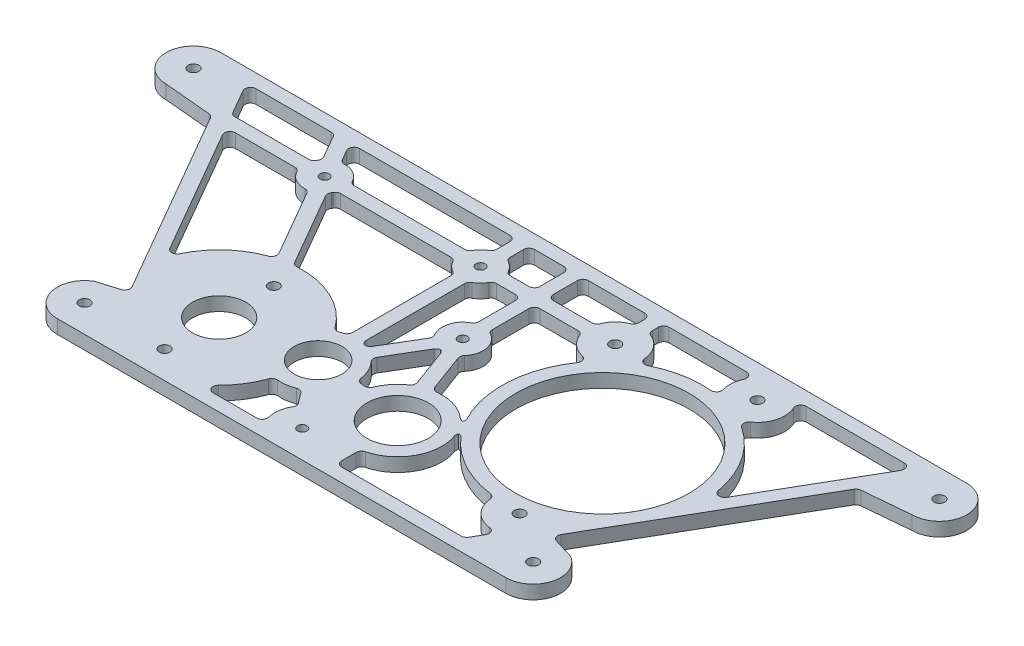
from build123d import *

# Parameters (mm, degrees)
SKETCH1_R           = 2.4892
SKETCH1_R_2         = 12.3825
SKETCH1_R_3         = 14.3002
SKETCH1_R_4         = 11.1252
SKETCH1_R_5         = 40.3225
BOSS_EXTRUDE1_DEPTH = 6.35
SKETCH2_R           = 2.15265
CUT_EXTRUDE1_DEPTH  = 200.93067318
FILLET1_R           = 2.54


with BuildPart() as part:
    # Sketch1 → Boss-Extrude1 (new body)
    with BuildSketch(Plane(origin=(0, 0, 0), x_dir=(1, 0, 0), z_dir=(0, 1, 0))):
        with BuildLine():
            ThreePointArc((-173.478687828, 72.590962089), (-186.178687828, 59.890962089), (-173.478687828, 47.190962089))
            Line((-173.478687828, 47.190962089), (-150.271339409, 45.094655518))
            Line((-150.271339409, 45.094655518), (-98.200516404, -45.094655518))
            Line((-98.200516404, -45.094655518), (-110.67256166, -48.892439461))
            ThreePointArc((-110.67256166, -48.892439461), (-116.589819654, -63.177963961), (-104.32256166, -72.590962089))
            Line((-104.32256166, -72.590962089), (104.322561739, -72.590962089))
            ThreePointArc((104.322561739, -72.590962089), (116.589819664, -63.177963923), (110.67256166, -48.892439461))
            Line((110.67256166, -48.892439461), (98.200516404, -45.094655518))
            Line((98.200516404, -45.094655518), (150.271339409, 45.094655518))
            Line((150.271339409, 45.094655518), (173.478687828, 47.190962089))
            ThreePointArc((173.478687828, 47.190962089), (186.178687828, 59.890962094), (173.478687816, 72.590962089))
            Line((173.478687816, 72.590962089), (-173.478687828, 72.590962089))
        make_face()
        with Locations(Location((173.478687828, 59.890962089, 0), (0, 0, 270))):
            Circle(SKETCH1_R, mode=Mode.SUBTRACT)
        with Locations(Location((-104.32256166, -59.890962089, 0), (0, 0, 270))):
            Circle(SKETCH1_R, mode=Mode.SUBTRACT)
        with Locations(Location((-67.13289048, -59.890962089, 0), (0, 0, 270))):
            Circle(SKETCH1_R, mode=Mode.SUBTRACT)
        with Locations(Location((-67.13289048, -34.490962089, 0), (0, 0, 270))):
            Circle(SKETCH1_R_2, mode=Mode.SUBTRACT)
        with Locations(Location((-67.13289048, -9.090962089, 0), (0, 0, 270))):
            Circle(SKETCH1_R, mode=Mode.SUBTRACT)
        with Locations(Location((15.87430952, -34.490962089, 0), (0, 0, 270))):
            Circle(SKETCH1_R_3, mode=Mode.SUBTRACT)
        with Locations(Location((81.671791392, -43.565397329, 0), (0, 0, 270))):
            Circle(SKETCH1_R, mode=Mode.SUBTRACT)
        with Locations(Location((-26.911726221, -28.671379147, 0), (0, 0, 270))):
            Circle(SKETCH1_R_4, mode=Mode.SUBTRACT)
        with Locations(Location((-173.478687828, 59.890962089, 0), (0, 0, 270))):
            Circle(SKETCH1_R, mode=Mode.SUBTRACT)
        with Locations(Location((72.644027153, 3.985206637, 0), (0, 0, 270))):
            Circle(SKETCH1_R_5, mode=Mode.SUBTRACT)
        with Locations(Location((35.710881273, 46.848232392, 0), (0, 0, 270))):
            Circle(SKETCH1_R, mode=Mode.SUBTRACT)
        with Locations(Location((91.297923401, 57.401762089, 0), (0, 0, 270))):
            Circle(SKETCH1_R, mode=Mode.SUBTRACT)
        with Locations(Location((104.32256166, -59.890962089, 0), (0, 0, 270))):
            Circle(SKETCH1_R, mode=Mode.SUBTRACT)
    extrude(amount=BOSS_EXTRUDE1_DEPTH)

    # Sketch2 → Cut-Extrude1 (cut, through all)
    with BuildSketch(Plane(origin=(0, 6.35, 0), x_dir=(1, 0, 0), z_dir=(0, 1, 0))):
        with BuildLine():
            Line((-114.291971392, 66.240962089), (-155.147816781, 66.240962089))
            Line((-155.147816781, 66.240962089), (-145.784506175, 50.023232392))
            Line((-145.784506175, 50.023232392), (-108.409655593, 50.023232392))
            ThreePointArc((-108.409655593, 50.023232392), (-107.678291443, 51.610732392), (-106.66915819, 53.037862326))
            Line((-106.66915819, 53.037862326), (-114.291971392, 66.240962089))
        make_face()
        with BuildLine():
            Line((-108.409655593, 43.673232392), (-142.118331966, 43.673232392))
            Line((-142.118331966, 43.673232392), (-103.826781824, -22.649677955))
            ThreePointArc((-103.826781824, -22.649677955), (-93.871605761, -6.711495265), (-77.565085515, 2.628129746))
            Line((-77.565085515, 2.628129746), (-97.688902069, 37.483602459))
            ThreePointArc((-97.688902069, 37.483602459), (-104.191899472, 38.599340421), (-108.409655593, 43.673232392))
        make_face()
        with BuildLine():
            Line((-30.086726221, 66.240962089), (-106.959622973, 66.240962089))
            Line((-106.959622973, 66.240962089), (-101.169896876, 56.212862326))
            ThreePointArc((-101.169896876, 56.212862326), (-94.666899472, 55.097124363), (-90.449143351, 50.023232392))
            Line((-90.449143351, 50.023232392), (-35.891982342, 50.023232392))
            ThreePointArc((-35.891982342, 50.023232392), (-33.646918312, 53.583424483), (-30.086726221, 55.828488513))
            Line((-30.086726221, 55.828488513), (-30.086726221, 66.240962089))
        make_face()
        with BuildLine():
            Line((-5.064866819, 66.240962089), (-23.736726221, 66.240962089))
            Line((-23.736726221, 66.240962089), (-23.736726221, 55.828488513))
            ThreePointArc((-23.736726221, 55.828488513), (-20.17653413, 53.583424483), (-17.9314701, 50.023232392))
            Line((-17.9314701, 50.023232392), (-5.064866819, 50.023232392))
            Line((-5.064866819, 50.023232392), (-5.064866819, 66.240962089))
        make_face()
        with BuildLine():
            ThreePointArc((-30.277440534, -45.819398922), (-36.042218421, -57.295079759), (-45.256072342, -66.240962089))
            Line((-45.256072342, -66.240962089), (-14.119970434, -66.240962089))
            ThreePointArc((-14.119970434, -66.240962089), (-15.846964873, -58.944223353), (-13.156814969, -51.945080588))
            Line((-13.156814969, -51.945080588), (-19.016243297, -44.261246512))
            ThreePointArc((-19.016243297, -44.261246512), (-24.516593521, -45.981663789), (-30.277440534, -45.819398922))
        make_face()
        with BuildLine():
            Line((-92.189640755, 40.658602459), (-70.953473966, 3.876482623))
            ThreePointArc((-70.953473966, 3.876482623), (-50.606128498, 0.34470656), (-34.999931114, -13.180622011))
            ThreePointArc((-34.999931114, -13.180622011), (-32.606637362, -12.15016242), (-30.086726221, -11.487026089))
            Line((-30.086726221, -11.487026089), (-30.086726221, 37.867976271))
            ThreePointArc((-30.086726221, 37.867976271), (-33.646918312, 40.113040302), (-35.891982342, 43.673232392))
            Line((-35.891982342, 43.673232392), (-90.449143351, 43.673232392))
            ThreePointArc((-90.449143351, 43.673232392), (-91.180507501, 42.085732392), (-92.189640755, 40.658602459))
        make_face()
        with BuildLine():
            Line((32.535881273, 66.240962089), (1.285133181, 66.240962089))
            Line((1.285133181, 66.240962089), (1.285133181, 50.023232392))
            Line((1.285133181, 50.023232392), (23.414159149, 50.023232392))
            ThreePointArc((23.414159149, 50.023232392), (26.730625152, 55.828488513), (32.535881273, 59.144954517))
            Line((32.535881273, 59.144954517), (32.535881273, 66.240962089))
        make_face()
        with BuildLine():
            Line((-5.064866819, 43.673232392), (-17.9314701, 43.673232392))
            ThreePointArc((-17.9314701, 43.673232392), (-20.17653413, 40.113040302), (-23.736726221, 37.867976271))
            Line((-23.736726221, 37.867976271), (-23.736726221, -11.487026089))
            ThreePointArc((-23.736726221, -11.487026089), (-22.292714572, -11.817674913), (-20.881895425, -12.269435494))
            Line((-20.881895425, -12.269435494), (-9.199683839, 7.442564292))
            ThreePointArc((-9.199683839, 7.442564292), (-11.076115494, 16.066928187), (-5.064866819, 22.529554413))
            Line((-5.064866819, 22.529554413), (-5.064866819, 43.673232392))
        make_face()
        with BuildLine():
            Line((82.178792776, 66.240962089), (38.885881273, 66.240962089))
            Line((38.885881273, 66.240962089), (38.885881273, 59.144954517))
            ThreePointArc((38.885881273, 59.144954517), (46.665897295, 53.272998845), (47.992817781, 43.616509072))
            ThreePointArc((47.992817781, 43.616509072), (63.938484083, 49.838622824), (81.055024467, 49.89356514))
            ThreePointArc((81.055024467, 49.89356514), (78.627824983, 58.272742044), (82.178792776, 66.240962089))
        make_face()
        with BuildLine():
            Line((23.414159149, 43.673232392), (1.285133181, 43.673232392))
            Line((1.285133181, 43.673232392), (1.285133181, 22.529554413))
            ThreePointArc((1.285133181, 22.529554413), (7.486163922, 15.227294875), (4.202636108, 6.227615898))
            Line((4.202636108, 6.227615898), (11.775395446, -14.251652232))
            ThreePointArc((11.775395446, -14.251652232), (22.183371247, -14.828141839), (30.983742744, -20.414890631))
            Line((30.983742744, -20.414890631), (32.317275486, -19.511077243))
            ThreePointArc((32.317275486, -19.511077243), (26.154677059, 8.115894717), (37.0917211, 34.223523233))
            ThreePointArc((37.0917211, 34.223523233), (28.491922042, 36.399470379), (23.414159149, 43.673232392))
        make_face()
        with BuildLine():
            Line((19.04930952, -54.895621729), (19.04930952, -66.240962089))
            Line((19.04930952, -66.240962089), (78.659342195, -66.240962089))
            Line((78.659342195, -66.240962089), (84.618890894, -55.918720952))
            ThreePointArc((84.618890894, -55.918720952), (73.408080674, -53.209104354), (69.012784333, -42.545818839))
            ThreePointArc((69.012784333, -42.545818839), (50.576773731, -37.140923532), (35.879883701, -24.76753258))
            Line((35.879883701, -24.76753258), (34.546350959, -25.671345967))
            ThreePointArc((34.546350959, -25.671345967), (34.118154464, -44.165303496), (19.04930952, -54.895621729))
        make_face()
        with BuildLine():
            Line((-3.736957371, 4.205108573), (-15.419168957, -15.506891213))
            ThreePointArc((-15.419168957, -15.506891213), (-11.17857628, -21.065420432), (-9.456248686, -27.841367671))
            Line((-9.456248686, -27.841367671), (-3.91627225, -28.594892782))
            ThreePointArc((-3.91627225, -28.594892782), (-0.235830951, -21.57221083), (5.819540332, -16.453989598))
            Line((5.819540332, -16.453989598), (-1.753219005, 4.025278532))
            ThreePointArc((-1.753219005, 4.025278532), (-2.749801875, 4.063195999), (-3.736957371, 4.205108573))
        make_face()
        with BuildLine():
            Line((155.147816781, 66.240962089), (100.417054026, 66.240962089))
            ThreePointArc((100.417054026, 66.240962089), (103.546778148, 54.046831779), (94.640137161, 45.149431405))
            ThreePointArc((94.640137161, 45.149431405), (112.625046332, 28.065081257), (119.316126255, 4.178653576))
            Line((119.316126255, 4.178653576), (155.147816781, 66.240962089))
        make_face()
        with Locations(Location((-99.429399472, 46.848232392, 0), (0, 0, 270))):
            Circle(SKETCH2_R)
        with Locations(Location((-26.911726221, 46.848232392, 0), (0, 0, 270))):
            Circle(SKETCH2_R)
        with Locations(Location((-3.17569048, -59.797924273, 0), (0, 0, 270))):
            Circle(SKETCH2_R)
        with Locations(Location((-1.889866819, 13.549298291, 0), (0, 0, 270))):
            Circle(SKETCH2_R)
    extrude(amount=-CUT_EXTRUDE1_DEPTH, mode=Mode.SUBTRACT)

    # Fillet1
    # the kernel refuses this fillet: 2.54 mm, written as the material it adds along each edge
    with BuildSketch(Plane(origin=(-106.66915819, 6.35, -53.037862326), x_dir=(-0.4999999999999449, 0, -0.8660254037844705), z_dir=(0, -1, 0)), Plane(origin=(-30.086726221, 6.35, -55.828488513), x_dir=(0, 0, -1), z_dir=(0, -1, 0)), Plane(origin=(-92.189640755, 6.35, -40.658602459), x_dir=(0.5000000000000435, 0, 0.8660254037844134), z_dir=(0, -1, 0)), Plane(origin=(-17.9314701, 6.35, -50.023232392), x_dir=(1, 0, 0), z_dir=(0, -1, 0)), Plane(origin=(-5.064866819, 6.35, -22.529554413), x_dir=(0, 0, -1), z_dir=(0, -1, 0)), Plane(origin=(-3.736957371, 6.35, -4.205108573), x_dir=(-0.5098355463151732, 0, 0.860271884762898), z_dir=(0, -1, 0))) as fillet1_piece_1:
        with BuildLine():
            CenterArc((1.645326216, -2.54), FILLET1_R, 90, 61.726286369)
            ThreePointArc((-0.591638487, -1.336842105), (-0.270133815, -0.679788504), (0, 0))
            Line((0, 0), (1.645326216, 0))
        make_face()
    extrude(amount=6.35)
    with BuildSketch(Plane(origin=(-108.409655593, 6.35, -50.023232392), x_dir=(-1, 0, 0), z_dir=(0, -1, 0)), Plane(origin=(-35.891982342, 6.35, -50.023232392), x_dir=(-1, 0, 0), z_dir=(0, -1, 0)), Plane(origin=(-101.169896876, 6.35, -56.212862326), x_dir=(-0.5000000000000248, 0, -0.8660254037844244), z_dir=(0, -1, 0)), Plane(origin=(-30.086726221, 6.35, -37.867976271), x_dir=(0, 0, 1), z_dir=(0, -1, 0)), Plane(origin=(-90.449143351, 6.35, -43.673232392), x_dir=(1, 0, 0), z_dir=(0, -1, 0)), Plane(origin=(-23.736726221, 6.35, -55.828488513), x_dir=(0, 0, -1), z_dir=(0, -1, 0)), Plane(origin=(-9.199683839, 6.35, -7.442564292), x_dir=(-0.5098355463151704, 0, 0.8602718847628997), z_dir=(0, -1, 0)), Plane(origin=(-17.9314701, 6.35, -43.673232392), x_dir=(1, 0, 0), z_dir=(0, -1, 0)), Plane(origin=(-1.753219005, 6.35, -4.025278532), x_dir=(0.34682478195255734, 0, 0.9379299390805056), z_dir=(0, -1, 0)), Plane(origin=(1.285133181, 6.35, -22.529554413), x_dir=(0, 0, -1), z_dir=(0, -1, 0)), Plane(origin=(-97.688902069, 6.35, -37.483602459), x_dir=(0.4999999999999665, 0, 0.8660254037844579), z_dir=(0, -1, 0))) as fillet1_piece_2:
        with BuildLine():
            CenterArc((1.645326216, 2.54), FILLET1_R, 208.273713631, 61.726286369)
            ThreePointArc((-0.591638487, 1.336842105), (-0.270133815, 0.679788504), (0, 0))
            Line((0, 0), (1.645326216, 0))
        make_face()
    extrude(amount=6.35)
    with BuildSketch(Plane(origin=(-145.784506175, 6.35, -50.023232392), x_dir=(-0.4999999999999971, 0, -0.8660254037844404), z_dir=(0, -1, 0)), Plane(origin=(-114.291971392, 6.35, -66.240962089), x_dir=(0.4999999999999971, 0, 0.8660254037844404), z_dir=(0, -1, 0)), Plane(origin=(78.659342195, 6.35, 66.240962089), x_dir=(-1, 0, 0), z_dir=(0, -1, 0))) as fillet1_piece_3:
        with BuildLine():
            CenterArc((FILLET1_R * 0.57735026919, FILLET1_R), FILLET1_R, 210, 60)
            Line((-FILLET1_R * 0.288675134595, FILLET1_R * 0.5), (0, 0))
            Line((0, 0), (FILLET1_R * 0.57735026919, 0))
        make_face()
    extrude(amount=6.35)
    with BuildSketch(Plane(origin=(-155.147816781, 6.35, -66.240962089), x_dir=(1, 0, 0), z_dir=(0, -1, 0)), Plane(origin=(-106.959622973, 6.35, -66.240962089), x_dir=(1, 0, 0), z_dir=(0, -1, 0)), Plane(origin=(155.147816781, 6.35, -66.240962089), x_dir=(-0.5000000000000048, 0, 0.8660254037844358), z_dir=(0, -1, 0)), Plane(origin=(-142.118331966, 6.35, -43.673232392), x_dir=(1, 0, 0), z_dir=(0, -1, 0))) as fillet1_piece_4:
        with BuildLine():
            CenterArc((FILLET1_R * 1.73205080757, FILLET1_R), FILLET1_R, 150, 120)
            Line((FILLET1_R * 0.866025403784, FILLET1_R * 1.5), (0, 0))
            Line((0, 0), (FILLET1_R * 1.73205080757, 0))
        make_face()
    extrude(amount=6.35)
    with BuildSketch(Plane(origin=(-90.449143351, 6.35, -50.023232392), x_dir=(-0.4047022051709242, 0, -0.9144485360750441), z_dir=(0, -1, 0)), Plane(origin=(-35.891982342, 6.35, -43.673232392), x_dir=(0.4047022051709187, 0, 0.9144485360750464), z_dir=(0, -1, 0)), Plane(origin=(-23.736726221, 6.35, -37.867976271), x_dir=(0.9144485360750448, 0, -0.40470220517092237), z_dir=(0, -1, 0)), Plane(origin=(4.202636108, 6.35, -6.227615898), x_dir=(0.7173279056690074, 0, -0.6967357287727647), z_dir=(0, -1, 0)), Plane(origin=(-108.409655593, 6.35, -43.673232392), x_dir=(0.404702205170935, 0, 0.9144485360750392), z_dir=(0, -1, 0))) as fillet1_piece_5:
        with BuildLine():
            CenterArc((1.656832134, 2.532509751), FILLET1_R, 203.872467133, 61.726286369)
            Line((-0.665867148, 1.50456615), (0, 0))
            ThreePointArc((0, 0), (0.730955353, 0.028088435), (1.461910706, 0))
        make_face()
    extrude(amount=6.35)
    with BuildSketch(Plane(origin=(-30.086726221, 6.35, -66.240962089), x_dir=(0, 0, 1), z_dir=(0, -1, 0)), Plane(origin=(38.885881273, 6.35, -66.240962089), x_dir=(1, 0, 0), z_dir=(0, -1, 0)), Plane(origin=(19.04930952, 6.35, 66.240962089), x_dir=(0, 0, -1), z_dir=(0, -1, 0)), Plane(origin=(-23.736726221, 6.35, -66.240962089), x_dir=(1, 0, 0), z_dir=(0, -1, 0)), Plane(origin=(-5.064866819, 6.35, -66.240962089), x_dir=(0, 0, 1), z_dir=(0, -1, 0)), Plane(origin=(-5.064866819, 6.35, -50.023232392), x_dir=(-1, 0, 0), z_dir=(0, -1, 0)), Plane(origin=(-5.064866819, 6.35, -43.673232392), x_dir=(0, 0, 1), z_dir=(0, -1, 0)), Plane(origin=(1.285133181, 6.35, -43.673232392), x_dir=(1, 0, 0), z_dir=(0, -1, 0)), Plane(origin=(1.285133181, 6.35, -50.023232392), x_dir=(0, 0, -1), z_dir=(0, -1, 0)), Plane(origin=(1.285133181, 6.35, -66.240962089), x_dir=(1, 0, 0), z_dir=(0, -1, 0)), Plane(origin=(32.535881273, 6.35, -66.240962089), x_dir=(0, 0, 1), z_dir=(0, -1, 0))) as fillet1_piece_6:
        with BuildLine():
            CenterArc((FILLET1_R, FILLET1_R), FILLET1_R, 180, 90)
            Line((0, FILLET1_R), (0, 0))
            Line((0, 0), (FILLET1_R, 0))
        make_face()
    extrude(amount=6.35)
    with BuildSketch(Plane(origin=(-30.086726221, 6.35, 11.487026089), x_dir=(-0.9722502226407513, 0, 0.23394337899374176), z_dir=(0, -1, 0)), Plane(origin=(-20.881895425, 6.35, 12.269435494), x_dir=(-0.9556721819283983, 0, -0.2944328118403492), z_dir=(0, -1, 0)), Plane(origin=(-9.456248686, 6.35, 27.841367671), x_dir=(-0.10077394544840815, 0, -0.9949093485935095), z_dir=(0, -1, 0))) as fillet1_piece_7:
        with BuildLine():
            CenterArc((2.002192205, 2.536375191), FILLET1_R, 193.529346775, 73.409289119)
            Line((-0.46732336, 1.942159009), (0, 0))
            ThreePointArc((0, 0), (0.933271163, 0.024938685), (1.866542327, 0))
        make_face()
    extrude(amount=6.35)
    with BuildSketch(Plane(origin=(-34.999931114, 6.35, 13.180622011), x_dir=(-0.574480497027429, 0, -0.8185182701290902), z_dir=(0, -1, 0))) as fillet1_piece_8:
        with BuildLine():
            CenterArc((2.10069809, 2.53911654), FILLET1_R, 193.928602659, 74.560180243)
            ThreePointArc((-0.364616858, 1.927706524), (-0.155234884, 0.968974099), (0, 0))
            ThreePointArc((0, 0), (1.016855772, 0.013410926), (2.033711543, 0))
        make_face()
    extrude(amount=6.35)
    with BuildSketch(Plane(origin=(-70.953473966, 6.35, -3.876482623), x_dir=(-0.5000000000000047, 0, -0.866025403784436), z_dir=(0, -1, 0))) as fillet1_piece_9:
        with BuildLine():
            CenterArc((1.603071132, 2.54), FILLET1_R, 206.620825162, 63.379174838)
            ThreePointArc((-0.667667105, 1.401866502), (-0.326775992, 0.704294556), (0, 0))
            Line((0, 0), (1.603071132, 0))
        make_face()
    extrude(amount=6.35)
    with BuildSketch(Plane(origin=(82.178792776, 6.35, -66.240962089), x_dir=(-0.5629589970624458, 0, 0.8264848260110073), z_dir=(0, -1, 0))) as fillet1_piece_10:
        with BuildLine():
            CenterArc((4.777889695, 2.502586051), FILLET1_R, 145.739319871, 114.414402315)
            Line((2.678618237, 3.932501904), (0, 0))
            ThreePointArc((0, 0), (2.171768043, 0.187069745), (4.343536086, 0))
        make_face()
    extrude(amount=6.35)
    with BuildSketch(Plane(origin=(81.055024467, 6.35, -49.89356514), x_dir=(-0.44549824782464786, 0, -0.8952828107280787), z_dir=(0, -1, 0))) as fillet1_piece_11:
        with BuildLine():
            CenterArc((4.749285509, -2.503035987), FILLET1_R, 99.786748421, 111.394026914)
            ThreePointArc((2.576218919, -3.818095527), (1.335237498, -1.877248626), (0, 0))
            ThreePointArc((0, 0), (2.15876614, -0.184820067), (4.31753228, 0))
        make_face()
    extrude(amount=6.35)
    with BuildSketch(Plane(origin=(47.992817781, 6.35, -43.616509072), x_dir=(0.08637714788447863, 0, -0.9962625097449682), z_dir=(0, -1, 0)), Plane(origin=(94.640137161, 6.35, -45.149431405), x_dir=(0.9059772162193113, 0, -0.4233264504983213), z_dir=(0, -1, 0))) as fillet1_piece_12:
        with BuildLine():
            CenterArc((4.749285509, 2.503035987), FILLET1_R, 148.819224665, 111.394026914)
            ThreePointArc((2.576218919, 3.818095527), (1.335237498, 1.877248626), (0, 0))
            ThreePointArc((0, 0), (2.15876614, 0.184820067), (4.31753228, 0))
        make_face()
    extrude(amount=6.35)
    with BuildSketch(Plane(origin=(38.885881273, 6.35, -59.144954517), x_dir=(0, 0, -1), z_dir=(0, -1, 0)), Plane(origin=(23.414159149, 6.35, -50.023232392), x_dir=(-1, 0, 0), z_dir=(0, -1, 0))) as fillet1_piece_13:
        with BuildLine():
            CenterArc((1.831135994, 2.54), FILLET1_R, 202.024312837, 67.975687163)
            ThreePointArc((-0.523507026, 1.5875), (-0.235606565, 0.802372432), (0, 0))
            Line((0, 0), (1.831135994, 0))
        make_face()
    extrude(amount=6.35)
    with BuildSketch(Plane(origin=(100.417054026, 6.35, -66.240962089), x_dir=(1, 0, 0), z_dir=(0, -1, 0))) as fillet1_piece_14:
        with BuildLine():
            CenterArc((4.758105388, 2.54), FILLET1_R, 155.585597685, 114.414402315)
            ThreePointArc((2.445232719, 3.589866667), (1.377226665, 1.689620737), (0, 0))
            Line((0, 0), (4.758105388, 0))
        make_face()
    extrude(amount=6.35)
    with BuildSketch(Plane(origin=(119.316126255, 6.35, -4.178653576), x_dir=(0.49999999999994416, 0, -0.8660254037844709), z_dir=(0, -1, 0))) as fillet1_piece_15:
        with BuildLine():
            CenterArc((8.029781391, -2.54), FILLET1_R, 90, 140.151547404)
            ThreePointArc((6.402253086, -4.490064516), (3.295328961, -2.110711756), (0, 0))
            Line((0, 0), (8.029781391, 0))
        make_face()
    extrude(amount=6.35)
    with BuildSketch(Plane(origin=(69.012784333, 6.35, 42.545818839), x_dir=(-0.9948351649370738, 0, -0.10150366793680525), z_dir=(0, -1, 0))) as fillet1_piece_16:
        with BuildLine():
            CenterArc((2.281603238, -2.539280809), FILLET1_R, 91.363493515, 78.011700125)
            ThreePointArc((-0.214850023, -2.070963489), (-0.064913437, -1.039892065), (0, 0))
            ThreePointArc((0, 0), (1.110581709, -0.013215131), (2.221163417, 0))
        make_face()
    extrude(amount=6.35)
    with BuildSketch(Plane(origin=(84.618890894, 6.35, 55.918720952), x_dir=(-0.4999999999999782, 0, 0.8660254037844511), z_dir=(0, -1, 0))) as fillet1_piece_17:
        with BuildLine():
            CenterArc((4.702023601, 2.54), FILLET1_R, 156.040083892, 113.959916108)
            ThreePointArc((2.380895947, 3.571487475), (1.342427099, 1.684428392), (0, 0))
            Line((0, 0), (4.702023601, 0))
        make_face()
    extrude(amount=6.35)
    with BuildSketch(Plane(origin=(19.04930952, 6.35, 54.895621729), x_dir=(0.9797304892019456, 0, -0.20032016505613306), z_dir=(0, -1, 0)), Plane(origin=(5.819540332, 6.35, 16.453989598), x_dir=(-0.8494425604862026, 0, 0.5276810934974306), z_dir=(0, -1, 0)), Plane(origin=(30.983742744, 6.35, 20.414890631), x_dir=(-0.7154913212941619, 0, -0.6986216208740854), z_dir=(0, -1, 0))) as fillet1_piece_18:
        with BuildLine():
            CenterArc((2.073791089, 2.537156666), FILLET1_R, 191.555682033, 75.73303264)
            Line((-0.414724354, 2.028343447), (0, 0))
            ThreePointArc((0, 0), (0.976820484, 0.023116304), (1.953640968, 0))
        make_face()
    extrude(amount=6.35)
    with BuildSketch(Plane(origin=(34.546350959, 6.35, 25.671345967), x_dir=(0.8277882419639014, 0, -0.5610406638259954), z_dir=(0, -1, 0)), Plane(origin=(-3.91627225, 6.35, 28.594892782), x_dir=(-0.9908762329901364, 0, -0.1347749639038247), z_dir=(0, -1, 0)), Plane(origin=(11.775395446, 6.35, 14.251652232), x_dir=(-0.3468247819525557, 0, -0.9379299390805061), z_dir=(0, -1, 0))) as fillet1_piece_19:
        with BuildLine():
            CenterArc((2.070307568, 2.54), FILLET1_R, 194.26696736, 75.73303264)
            ThreePointArc((-0.391353681, 1.914041621), (-0.173029092, 0.961651472), (0, 0))
            Line((0, 0), (2.070307568, 0))
        make_face()
    extrude(amount=6.35)
    with BuildSketch(Plane(origin=(35.879883701, 6.35, 24.76753258), x_dir=(0.6348992784812808, 0, 0.7725949172651533), z_dir=(0, -1, 0))) as fillet1_piece_20:
        with BuildLine():
            CenterArc((2.315966046, 2.53925898), FILLET1_R, 185.28471737, 83.331249825)
            Line((-0.213237179, 2.305312299), (0, 0))
            ThreePointArc((0, 0), (1.127307976, 0.013616248), (2.254615952, 0))
        make_face()
    extrude(amount=6.35)
    with BuildSketch(Plane(origin=(-13.156814969, 6.35, 51.945080588), x_dir=(-0.5652720723432407, 0, 0.8249045303723201), z_dir=(0, -1, 0))) as fillet1_piece_21:
        with BuildLine():
            CenterArc((1.838749898, 2.534493607), FILLET1_R, 198.250912511, 67.975687163)
            Line((-0.573473214, 1.73901912), (0, 0))
            ThreePointArc((0, 0), (0.835795408, 0.027531967), (1.671590816, 0))
        make_face()
    extrude(amount=6.35)
    with BuildSketch(Plane(origin=(-14.119970434, 6.35, 66.240962089), x_dir=(-1, 0, 0), z_dir=(0, -1, 0))) as fillet1_piece_22:
        with BuildLine():
            CenterArc((3.787450963, 2.54), FILLET1_R, 165.160937819, 104.839062181)
            ThreePointArc((1.332162477, 3.190506303), (0.775161997, 1.549707624), (0, 0))
            Line((0, 0), (3.787450963, 0))
        make_face()
    extrude(amount=6.35)
    with BuildSketch(Plane(origin=(-45.256072342, 6.35, 66.240962089), x_dir=(1, 0, 0), z_dir=(0, -1, 0))) as fillet1_piece_23:
        with BuildLine():
            CenterArc((7.032622324, -2.54), FILLET1_R, 90, 135.296297407)
            ThreePointArc((5.245883112, -4.345315204), (2.719089369, -2.056583125), (0, 0))
            Line((0, 0), (7.032622324, 0))
        make_face()
    extrude(amount=6.35)
    with BuildSketch(Plane(origin=(-30.277440534, 6.35, 45.819398922), x_dir=(0.9905415218231438, 0, 0.1372133140197786), z_dir=(0, -1, 0))) as fillet1_piece_24:
        with BuildLine():
            CenterArc((2.104465258, 2.535995119), FILLET1_R, 192.221918917, 74.560180243)
            ThreePointArc((-0.377965588, 1.998280425), (-0.175805512, 1.001632635), (0, 0))
            ThreePointArc((0, 0), (0.980943156, 0.027553581), (1.961886311, 0))
        make_face()
    extrude(amount=6.35)
    with BuildSketch(Plane(origin=(-19.016243297, 6.35, 44.261246512), x_dir=(0.6063756936256809, 0, 0.7951782933279646), z_dir=(0, -1, 0)), Plane(origin=(-23.736726221, 6.35, 11.487026089), x_dir=(0, 0, -1), z_dir=(0, -1, 0)), Plane(origin=(-15.419168957, 6.35, 15.506891213), x_dir=(0.5098355463151722, 0, -0.8602718847628986), z_dir=(0, -1, 0))) as fillet1_piece_25:
        with BuildLine():
            CenterArc((1.997591734, 2.54), FILLET1_R, 196.590710881, 73.409289119)
            ThreePointArc((-0.436665219, 1.814746193), (-0.194085968, 0.913207337), (0, 0))
            Line((0, 0), (1.997591734, 0))
        make_face()
    extrude(amount=6.35)
    with BuildSketch(Plane(origin=(23.414159149, 6.35, -43.673232392), x_dir=(-1, 0, 0), z_dir=(0, -1, 0)), Plane(origin=(32.535881273, 6.35, -59.144954517), x_dir=(0, 0, -1), z_dir=(0, -1, 0))) as fillet1_piece_26:
        with BuildLine():
            CenterArc((1.831135994, -2.54), FILLET1_R, 90, 67.975687163)
            ThreePointArc((-0.523507026, -1.5875), (-0.235606565, -0.802372432), (0, 0))
            Line((0, 0), (1.831135994, 0))
        make_face()
    extrude(amount=6.35)
    with BuildSketch(Plane(origin=(37.0917211, 6.35, -34.223523233), x_dir=(-0.6095069993867882, 0, 0.7927806870115554), z_dir=(0, -1, 0))) as fillet1_piece_27:
        with BuildLine():
            CenterArc((4.731279962, 2.536905972), FILLET1_R, 155.777663156, 111.394026914)
            ThreePointArc((2.414900958, 3.579013601), (1.360656869, 1.686132436), (0, 0))
            ThreePointArc((0, 0), (2.302974021, 0.056852767), (4.605948043, 0))
        make_face()
    extrude(amount=6.35)
    with BuildSketch(Plane(origin=(32.317275486, 6.35, 19.511077243), x_dir=(-0.8277882419638987, 0, 0.5610406638259993), z_dir=(0, -1, 0))) as fillet1_piece_28:
        with BuildLine():
            CenterArc((2.315153319, 2.54), FILLET1_R, 186.668750176, 83.331249824)
            ThreePointArc((-0.207661385, 2.245032258), (-0.090272323, 1.123770253), (0, 0))
            Line((0, 0), (2.315153319, 0))
        make_face()
    extrude(amount=6.35)
    with BuildSketch(Plane(origin=(150.271339409, 0, -45.094655518), x_dir=(0.9959450943889483, 0, -0.08996315336063304), z_dir=(0, 1, 0))) as fillet1_piece_29:
        with BuildLine():
            CenterArc((FILLET1_R * 0.518777228746, -FILLET1_R), FILLET1_R, 90, 54.838512665)
            Line((-FILLET1_R * 0.298754947089, -FILLET1_R * 0.424117076591), (0, 0))
            Line((0, 0), (FILLET1_R * 0.518777228746, 0))
        make_face()
    extrude(amount=6.35)
    with BuildSketch(Plane(origin=(98.200516404, 0, 45.094655518), x_dir=(0.5000000000000044, 0, -0.866025403784436), z_dir=(0, 1, 0))) as fillet1_piece_30:
        with BuildLine():
            CenterArc((FILLET1_R * 1.2586215929, -FILLET1_R), FILLET1_R, 90, 103.06431343)
            Line((FILLET1_R * 0.284504645203, -FILLET1_R * 1.22604462438), (0, 0))
            Line((0, 0), (FILLET1_R * 1.2586215929, 0))
        make_face()
    extrude(amount=6.35)
    with BuildSketch(Plane(origin=(-98.200516404, 0, 45.094655518), x_dir=(-0.5000000000000007, 0, -0.8660254037844384), z_dir=(0, 1, 0))) as fillet1_piece_31:
        with BuildLine():
            CenterArc((FILLET1_R * 1.2586215929, FILLET1_R), FILLET1_R, 166.93568657, 103.06431343)
            Line((FILLET1_R * 0.284504645203, FILLET1_R * 1.22604462438), (0, 0))
            Line((0, 0), (FILLET1_R * 1.2586215929, 0))
        make_face()
    extrude(amount=6.35)
    with BuildSketch(Plane(origin=(-150.271339409, 0, -45.094655518), x_dir=(-0.9959450943889627, 0, -0.08996315336047257), z_dir=(0, 1, 0))) as fillet1_piece_32:
        with BuildLine():
            CenterArc((FILLET1_R * 0.518777228746, FILLET1_R), FILLET1_R, 215.161487335, 54.838512665)
            Line((-FILLET1_R * 0.298754947089, FILLET1_R * 0.424117076591), (0, 0))
            Line((0, 0), (FILLET1_R * 0.518777228746, 0))
        make_face()
    extrude(amount=6.35)
    with BuildSketch(Plane(origin=(-77.565085515, 6.35, -2.628129746), x_dir=(-0.4999999999999944, 0, -0.8660254037844419), z_dir=(0, -1, 0))) as fillet1_piece_33:
        with BuildLine():
            CenterArc((3.137080585, -2.54), FILLET1_R, 90, 99.785662991)
            ThreePointArc((0.63403642, -2.97170581), (0.34630362, -1.479604636), (0, 0))
            Line((0, 0), (3.137080585, 0))
        make_face()
    extrude(amount=6.35)
    with BuildSketch(Plane(origin=(-103.826781824, 6.35, 22.649677955), x_dir=(-0.5000000000000379, 0, -0.8660254037844167), z_dir=(0, -1, 0))) as fillet1_piece_34:
        with BuildLine():
            CenterArc((5.240305881, 2.54), FILLET1_R, 145.433169667, 124.566830333)
            ThreePointArc((3.148704866, 3.981112485), (1.639934243, 1.938686881), (0, 0))
            Line((0, 0), (5.240305881, 0))
        make_face()
    extrude(amount=6.35)


solid = part.part
